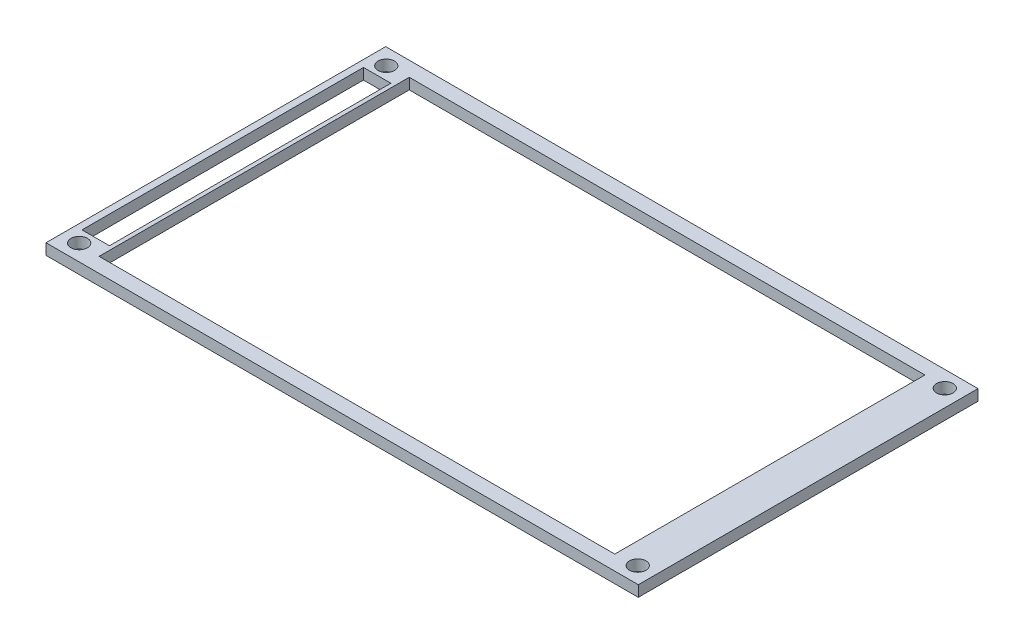
from build123d import *

# Parameters (mm, degrees)
SKETCH1_W               = 108
SKETCH1_H               = 61.936744186
BOSS_EXTRUDE1_DEPTH     = 2
SKETCH2_R               = 1.5
CUT_EXTRUDE1_DEPTH      = 63.28194016
MIRROR2_COPY_1_SKETCH_R = 1.5
MIRROR2_COPY_1_DEPTH    = 63.28194016
MIRROR2_COPY_2_SKETCH_R = 1.5
MIRROR2_COPY_2_DEPTH    = 63.28194016
SKETCH3_W               = 94.024869854
SKETCH3_H               = 56.555498618
CUT_EXTRUDE2_DEPTH      = 63.28194016
SKETCH4_W               = 5.000696719
SKETCH4_H               = 51.316673482
CUT_EXTRUDE3_DEPTH      = 63.28194016


with BuildPart() as part:
    # Sketch1 → Boss-Extrude1 (new body)
    with BuildSketch(Plane(origin=(0, 0, 0), x_dir=(1, 0, 0), z_dir=(0, 1, 0))):
        Rectangle(SKETCH1_W, SKETCH1_H)
    extrude(amount=BOSS_EXTRUDE1_DEPTH)

    # Sketch2 → Cut-Extrude1 (cut, through all)
    with BuildSketch(Plane(origin=(0, 2, 0), x_dir=(1, 0, 0), z_dir=(0, 1, 0))):
        with Locations((-50.921572875, 27.996572875)):
            Circle(SKETCH2_R)
    cut_extrude1 = extrude(amount=-CUT_EXTRUDE1_DEPTH, mode=Mode.SUBTRACT)

    # Mirror1: Cut-Extrude1 across plane
    add(cut_extrude1.mirror(Plane.XY), mode=Mode.SUBTRACT)

    # Mirror2 copy 1 sketch → Mirror2 copy 1 (cut, through all)
    with BuildSketch(Plane(origin=(0, 2, 0), x_dir=(-1, 0, 0), z_dir=(0, 1, 0))):
        with Locations((-50.921572875, 27.996572875)):
            Circle(MIRROR2_COPY_1_SKETCH_R)
    extrude(amount=-MIRROR2_COPY_1_DEPTH, mode=Mode.SUBTRACT)

    # Mirror2 copy 2 sketch → Mirror2 copy 2 (cut, through all)
    with BuildSketch(Plane(origin=(0, 2, 0), x_dir=(-1, 0, 0), z_dir=(0, 1, 0))):
        with Locations((-50.921572875, -27.996572875)):
            Circle(MIRROR2_COPY_2_SKETCH_R)
    extrude(amount=-MIRROR2_COPY_2_DEPTH, mode=Mode.SUBTRACT)

    # Sketch3 → Cut-Extrude2 (cut, through all)
    with BuildSketch(Plane(origin=(0, 2, 0), x_dir=(1, 0, 0), z_dir=(0, 1, 0))):
        Rectangle(SKETCH3_W, SKETCH3_H)
    extrude(amount=-CUT_EXTRUDE2_DEPTH, mode=Mode.SUBTRACT)

    # Sketch4 → Cut-Extrude3 (cut, through all)
    with BuildSketch(Plane(origin=(0, 2, 0), x_dir=(1, 0, 0), z_dir=(0, 1, 0))):
        with Locations((-50.245095613, 0)):
            Rectangle(SKETCH4_W, SKETCH4_H)
    extrude(amount=-CUT_EXTRUDE3_DEPTH, mode=Mode.SUBTRACT)


solid = part.part
